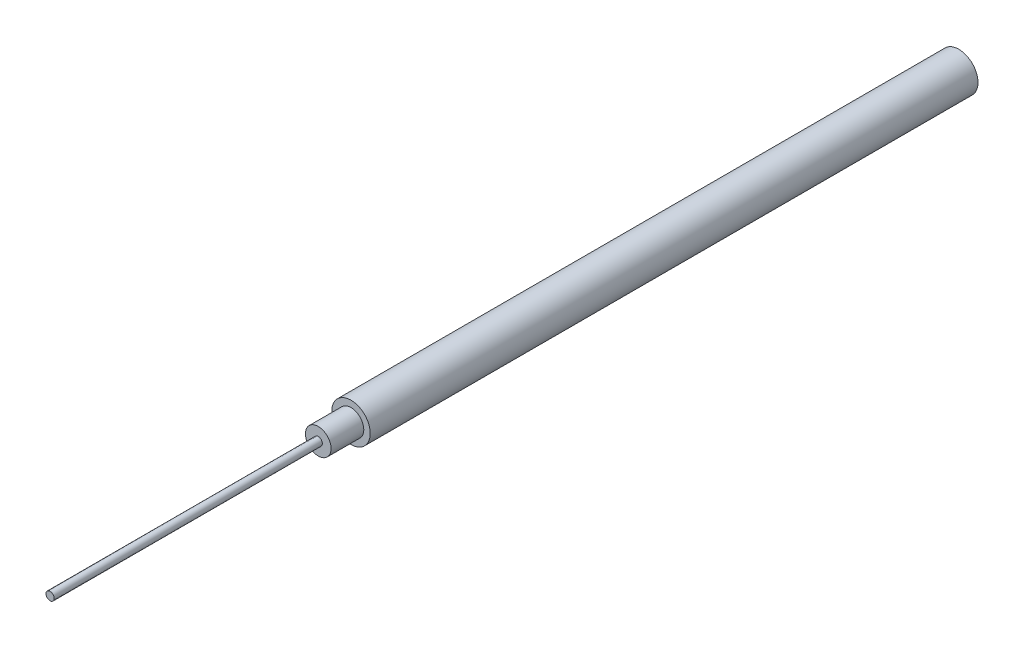
from build123d import *

# Parameters (mm, degrees)
SKETCH1_R           = 4.7625
BOSS_EXTRUDE1_DEPTH = 150.5
SKETCH2_R           = 3.175
BOSS_EXTRUDE2_DEPTH = 158.6
SKETCH3_R           = 1.016
BOSS_EXTRUDE3_DEPTH = 225


with BuildPart() as part:
    # Sketch1 → Boss-Extrude1 (new body)
    with BuildSketch(Plane.XY):
        Circle(SKETCH1_R)
    extrude(amount=BOSS_EXTRUDE1_DEPTH)

    # Sketch2 → Boss-Extrude2 (add)
    with BuildSketch(Plane.XY):
        Circle(SKETCH2_R)
    extrude(amount=BOSS_EXTRUDE2_DEPTH)

    # Sketch3 → Boss-Extrude3 (add)
    with BuildSketch(Plane.XY):
        Circle(SKETCH3_R)
    extrude(amount=BOSS_EXTRUDE3_DEPTH)


solid = part.part
